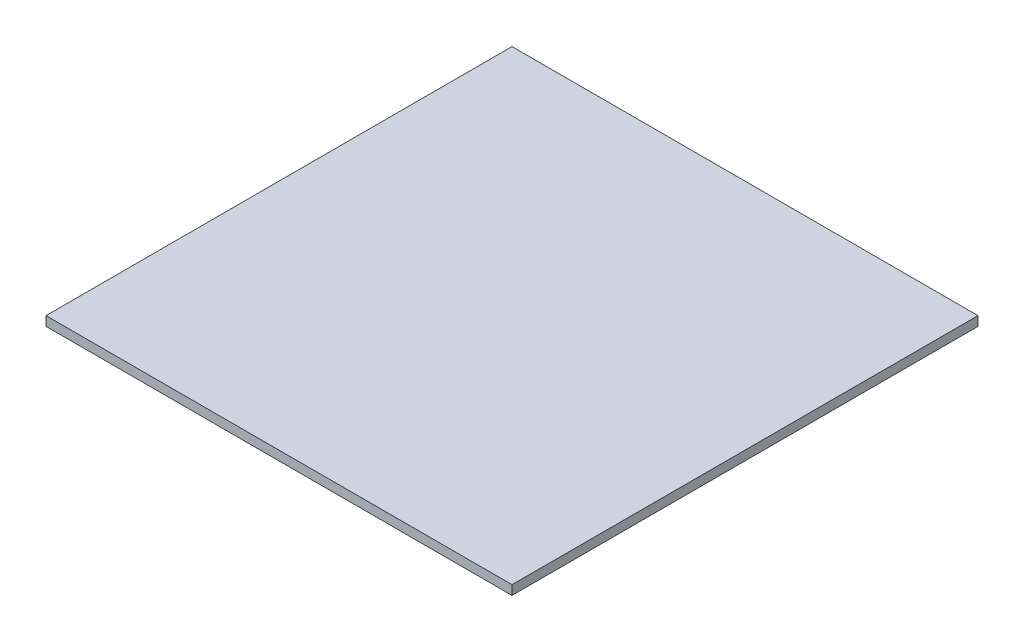
from build123d import *

# Parameters (mm, degrees)
SKETCH1_W           = 100
SKETCH1_H           = 100
BOSS_EXTRUDE1_DEPTH = 2


with BuildPart() as part:
    # Sketch1 → Boss-Extrude1 (new body)
    with BuildSketch(Plane(origin=(0, 0, 0), x_dir=(1, 0, 0), z_dir=(0, 1, 0))):
        with Locations((50, 50)):
            Rectangle(SKETCH1_W, SKETCH1_H)
    extrude(amount=BOSS_EXTRUDE1_DEPTH)


solid = part.part
